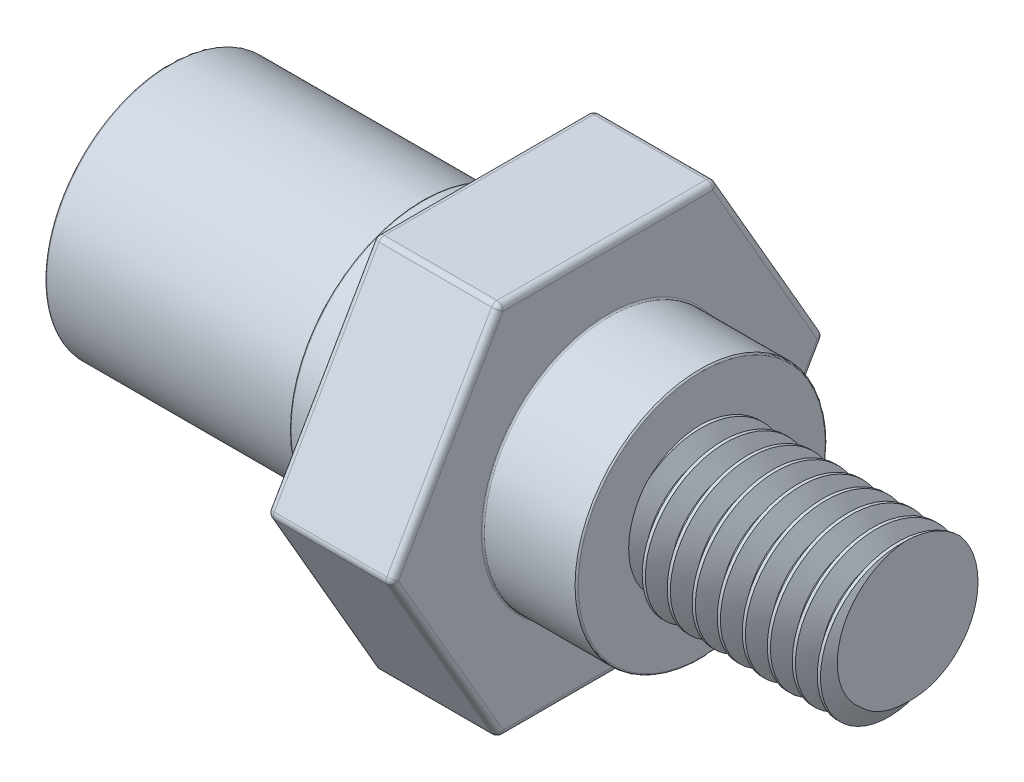
from build123d import *

# Parameters (mm, degrees)
SKETCH1_R                = 4
BOSS_EXTRUDE1_DEPTH      = 4
SKETCH1_4_R              = 2.5
BOSS_EXTRUDE3_DEPTH      = 13.5
CUT_SWEEP1_PITCH         = 0.8
CUT_SWEEP1_HEIGHT        = 7.2
CUT_SWEEP1_RADIUS        = 2
CUT_SWEEP1_START_ANGLE   = -90
BOSS_EXTRUDE2_DEPTH      = 7
BOSS_EXTRUDE2_DEPTH_BACK = 10
SKETCH1_2_R              = 4
SKETCH1_2_R_2            = 3
SKETCH1_2_R_3            = 2.5
SKETCH1_5_R              = 3
SKETCH1_5_R_2            = 2.5
CUT_EXTRUDE1_DEPTH       = 21
BOSS_EXTRUDE4_START      = -2
SKETCH1_6_R              = 4.25
SKETCH1_6_R_2            = 4
BOSS_EXTRUDE4_DEPTH      = 2
CHAMFER1_SIZE            = 0.2
CHAMFER1_SIZE2           = 0.084894963
FILLET1_R                = 0.05
FILLET2_R                = 0.2


with BuildPart() as part:
    # Sketch1 → Boss-Extrude1 (new body)
    with BuildSketch(Plane(origin=(0, 0, 0), x_dir=(0, 0, -1), z_dir=(1, 0, 0))):
        Polygon((6.92820323, 0), (3.464101615, 6), (-3.464101615, 6), (-6.92820323, 0), (-3.464101615, -6), (3.464101615, -6), align=None)
        Circle(SKETCH1_R, mode=Mode.SUBTRACT)
    extrude(amount=BOSS_EXTRUDE1_DEPTH)



with BuildPart() as body_2:
    # Sketch1<4> → Boss-Extrude3 (new body)
    with BuildSketch(Plane(origin=(0, 0, 0), x_dir=(0, 0, -1), z_dir=(1, 0, 0))):
        Circle(SKETCH1_4_R)
    extrude(amount=BOSS_EXTRUDE3_DEPTH)

    # Cut-Sweep1: sweep along a helix
    with BuildLine() as cut_sweep1_path:
        add(Helix(CUT_SWEEP1_PITCH, CUT_SWEEP1_HEIGHT, CUT_SWEEP1_RADIUS, center=(13.5, 0, 0), direction=(-1, 0, 0), lefthand=True, mode=Mode.PRIVATE).rotate(Axis((13.5, 0, 0), (-1, 0, 0)), CUT_SWEEP1_START_ANGLE))
    # Sketch3 → Cut-Sweep1 (sweep, cut)
    with BuildSketch(Plane.XY):
        Polygon((14.363336389, 2.782906924), (13.336663611, 2.782906924), (13.8, 1.980384758), (13.9, 1.980384758), align=None)
    sweep(path=cut_sweep1_path.line, is_frenet=True, mode=Mode.SUBTRACT)

    # Sketch1<2> → Boss-Extrude2 (add, two sides: drawn at the far end of the back side and taken through both)
    # profile 1 of 3: a face of its own
    with BuildSketch(Plane(origin=(0, 0, 0), x_dir=(0, 0, -1), z_dir=(1, 0, 0)).offset(-BOSS_EXTRUDE2_DEPTH_BACK)):
        Circle(SKETCH1_2_R)
    # profile 2 of 3: a face of its own
    with BuildSketch(Plane(origin=(0, 0, 0), x_dir=(0, 0, -1), z_dir=(1, 0, 0)).offset(-BOSS_EXTRUDE2_DEPTH_BACK)):
        Circle(SKETCH1_2_R_2)
        Circle(SKETCH1_2_R_3, mode=Mode.SUBTRACT)
    # profile 3 of 3: a face of its own
    with BuildSketch(Plane(origin=(0, 0, 0), x_dir=(0, 0, -1), z_dir=(1, 0, 0)).offset(-BOSS_EXTRUDE2_DEPTH_BACK)):
        Circle(SKETCH1_2_R_3)
    extrude(amount=BOSS_EXTRUDE2_DEPTH + BOSS_EXTRUDE2_DEPTH_BACK)

    # Sketch1<5> → Cut-Extrude1 (cut)
    # profile 1 of 2: a face of its own
    with BuildSketch(Plane(origin=(0, 0, 0), x_dir=(0, 0, -1), z_dir=(1, 0, 0))):
        Circle(SKETCH1_5_R)
        Circle(SKETCH1_5_R_2, mode=Mode.SUBTRACT)
    # profile 2 of 2: a face of its own
    with BuildSketch(Plane(origin=(0, 0, 0), x_dir=(0, 0, -1), z_dir=(1, 0, 0))):
        Circle(SKETCH1_5_R_2)
    extrude(amount=-CUT_EXTRUDE1_DEPTH, mode=Mode.SUBTRACT)


with BuildPart() as part_1:
    add(part.part)

    add(body_2.part)  # Boss-Extrude4 merges body 2
    # Sketch1<6> → Boss-Extrude4 (add)
    with BuildSketch(Plane(origin=(0, 0, 0), x_dir=(0, 0, -1), z_dir=(1, 0, 0)).offset(BOSS_EXTRUDE4_START)):
        Circle(SKETCH1_6_R)
        Circle(SKETCH1_6_R_2, mode=Mode.SUBTRACT)
    extrude(amount=BOSS_EXTRUDE4_DEPTH)

    # Chamfer1
    chamfer1_edges = [part_1.edges().sort_by_distance(p)[0] for p in [
        (-2, 0, 4.25),
    ]]
    chamfer1_side = [part_1.faces().sort_by_distance(p)[0] for p in [
        (-2, 0, 4.129791847),
    ]]
    chamfer(chamfer1_edges, length=CHAMFER1_SIZE, length2=CHAMFER1_SIZE2, reference=chamfer1_side[0])

    # Fillet1
    fillet1_edges = [part_1.edges().sort_by_distance(p)[0] for p in [
        (4, 0, 4),
        (0, 0, 4.25),
        (-2, 0, 4),
        (-10, 0, 4),
        (7, 0, 4),
        (-1.915105037, 0, 4.25),
    ]]
    fillet(fillet1_edges, radius=FILLET1_R - 0.0001)  # a hair under: the kernel refuses the full size

    # Fillet2
    fillet2_edges = [part_1.edges().sort_by_distance(p)[0] for p in [
        (4, -3, -5.196152423),
        (0, 6, 0),
        (0, 3, -5.196152423),
        (0, -3, -5.196152423),
        (0, -6, 0),
        (2, -6, 3.464101615),
        (4, 3, -5.196152423),
        (2, 0, 6.92820323),
        (2, 6, 3.464101615),
        (2, 6, -3.464101615),
        (2, 0, -6.92820323),
        (2, -6, -3.464101615),
        (4, 6, 0),
        (4, 3, 5.196152423),
        (4, -3, 5.196152423),
        (4, -6, 0),
        (0, -3, 5.196152423),
        (0, 3, 5.196152423),
    ]]
    fillet(fillet2_edges, radius=FILLET2_R)


solid = part_1.part
